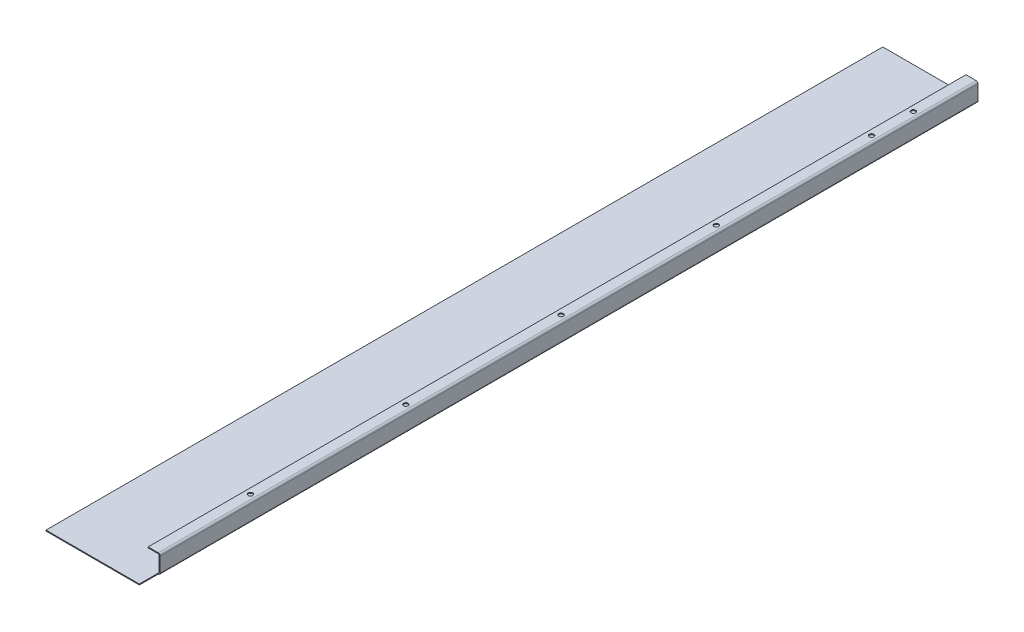
from build123d import *

# Parameters (mm, degrees)
SKETCH1_W                    = 103
SKETCH1_H                    = 905.2
BASE_FLANGE1_DEPTH           = 1
EDGE_FLANGE1_STRIP_W         = 6
EDGE_FLANGE1_STRIP_H         = 1
EDGE_FLANGE1_STRIP_CUT_DEPTH = 905.2
EDGE_FLANGE1_DEPTH           = 905.2
EDGE_FLANGE2_STRIP_W         = 6
EDGE_FLANGE2_STRIP_H         = 1
EDGE_FLANGE2_STRIP_CUT_DEPTH = 905.2
EDGE_FLANGE2_DEPTH           = 905.2
SKETCH19_R                   = 2.5
CUT_EXTRUDE2_DEPTH           = 10
CUT_EXTRUDE3_START           = -20.5
CUT_EXTRUDE3_DEPTH           = 20.5


# Read off the part's stored shape, not the designer's step: Cut-Extrude3
# Sheet-metal steps are written as plain solids
with BuildPart() as part:
    # Sketch1 → Base-Flange1 (new body)
    with BuildSketch(Plane(origin=(0, 0, 0), x_dir=(1, 0, 0), z_dir=(0, 1, 0))):
        with Locations((51.5, 452.6)):
            Rectangle(SKETCH1_W, SKETCH1_H)
    extrude(amount=-BASE_FLANGE1_DEPTH)

    # Edge-Flange1 strip (across the edge) → Edge-Flange1 strip cut (cut)
    with BuildSketch(Plane(origin=(103, 0, 0), x_dir=(-1, 0, 0), z_dir=(0, 0, -1))):
        with Locations((-1, -0.5)):
            Rectangle(EDGE_FLANGE1_STRIP_W, EDGE_FLANGE1_STRIP_H)
    extrude(amount=EDGE_FLANGE1_STRIP_CUT_DEPTH, mode=Mode.SUBTRACT)

    # Edge-Flange1 section (across the edge) → Edge-Flange1 (add)
    with BuildSketch(Plane(origin=(103, 0, 0), x_dir=(-1, 0, 0), z_dir=(0, 0, -1))):
        with BuildLine():
            Line((0, 1), (0, 19))
            Line((0, 19), (1, 19))
            Line((1, 19), (1, 1))
            ThreePointArc((1, 1), (1.292893219, 0.292893219), (2, 0))
            Line((2, 0), (2, -1))
            ThreePointArc((2, -1), (0.585786438, -0.414213562), (0, 1))
        make_face()
    extrude(amount=EDGE_FLANGE1_DEPTH)

    # Edge-Flange2 strip (across the edge) → Edge-Flange2 strip cut (cut)
    with BuildSketch(Plane(origin=(102, 19, 0), x_dir=(0, -1, 0), z_dir=(0, 0, -1))):
        with Locations((-1, -0.5)):
            Rectangle(EDGE_FLANGE2_STRIP_W, EDGE_FLANGE2_STRIP_H)
    extrude(amount=EDGE_FLANGE2_STRIP_CUT_DEPTH, mode=Mode.SUBTRACT)

    # Edge-Flange2 section (across the edge) → Edge-Flange2 (add)
    with BuildSketch(Plane(origin=(102, 19, 0), x_dir=(0, -1, 0), z_dir=(0, 0, -1))):
        with BuildLine():
            Line((0, 1), (0, 12))
            Line((0, 12), (1, 12))
            Line((1, 12), (1, 1))
            ThreePointArc((1, 1), (1.292893219, 0.292893219), (2, 0))
            Line((2, 0), (2, -1))
            ThreePointArc((2, -1), (0.585786438, -0.414213562), (0, 1))
        make_face()
    extrude(amount=EDGE_FLANGE2_DEPTH)

    # Sketch19 → Cut-Extrude2 (cut)
    with BuildSketch(Plane(origin=(0, 19, 0), x_dir=(1, 0, 0), z_dir=(0, 1, 0))):
        with Locations(Location((96, 842.2, 0), (0, 0, 180))):
            Circle(SKETCH19_R)
        with Locations(Location((96, 797.2, 0), (0, 0, 180))):
            Circle(SKETCH19_R)
        with Locations(Location((96, 629.2, 0), (0, 0, 180))):
            Circle(SKETCH19_R)
        with Locations(Location((96, 461.2, 0), (0, 0, 180))):
            Circle(SKETCH19_R)
        with Locations(Location((96, 293.2, 0), (0, 0, 180))):
            Circle(SKETCH19_R)
        with Locations(Location((96, 125.2, 0), (0, 0, 180))):
            Circle(SKETCH19_R)
    extrude(amount=-CUT_EXTRUDE2_DEPTH, mode=Mode.SUBTRACT)

    # Cut-Extrude3 outline → Cut-Extrude3 (cut)
    with BuildSketch(Plane.XY.offset(CUT_EXTRUDE3_START)):
        with BuildLine():
            ThreePointArc((102, 1), (101.707106781, 0.292893219), (101, 0))
            Line((101, 0), (101, -1))
            ThreePointArc((101, -1), (102.414213562, -0.414213562), (103, 1))
            Line((103, 1), (103, 17))
            ThreePointArc((103, 17), (102.414213562, 18.414213562), (101, 19))
            Line((101, 19), (90, 19))
            Line((90, 19), (90, 18))
            Line((90, 18), (101, 18))
            ThreePointArc((101, 18), (101.707106781, 17.707106781), (102, 17))
            Line((102, 17), (102, 1))
        make_face()
    extrude(amount=CUT_EXTRUDE3_DEPTH, mode=Mode.SUBTRACT)


solid = part.part
